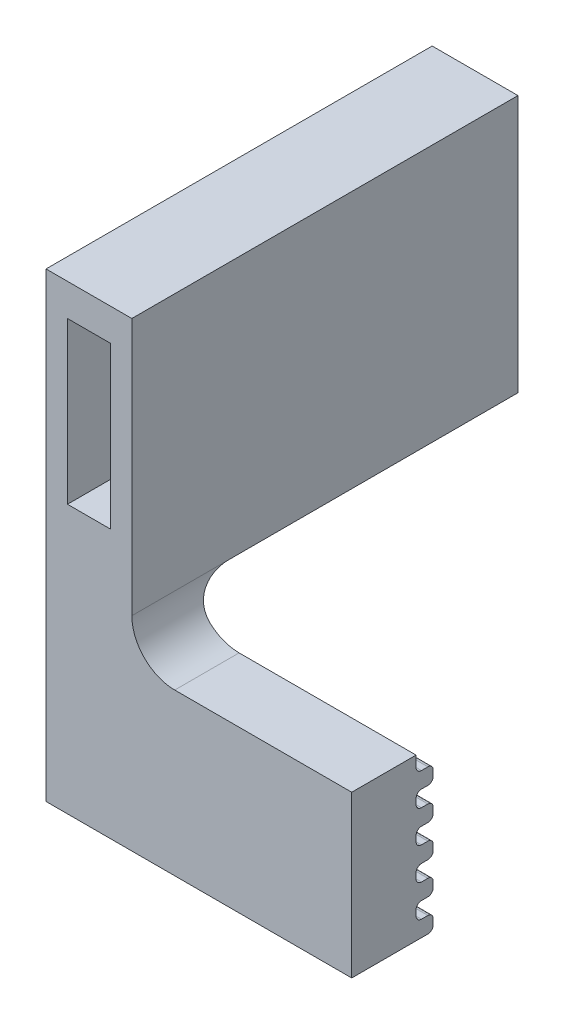
from build123d import *

# Parameters (mm, degrees)
SKETCH_1_W          = 8
SKETCH_1_H          = 24
SKETCH_1_W_2        = 4
SKETCH_1_H_2        = 15
EXTRUDE_1_DEPTH     = 8
SKETCH_1_3_W        = 8
SKETCH_1_3_H        = 24
SKETCH_1_3_W_2      = 4
SKETCH_1_3_H_2      = 15
EXTRUDE_2_DEPTH     = 28
EXTRUDE_4_DEPTH     = 6
CUT_EXTRUDE_2_DEPTH = 6
SKETCH_4_W          = 8
SKETCH_4_H          = 4
EXTRUDE_5_DEPTH     = 6
FILLET_1_R          = 2
FILLET_2_R          = 3
FILLET_3_R          = 4
SKETCH_6_W          = 1.6
SKETCH_6_H          = 1.5
EXTRUDE_7_DEPTH     = 28.5
FILLET_5_R          = 0.5


with BuildPart() as part:
    # Эскиз1 → Бобышка-Вытянуть1 (new body)
    with BuildSketch(Plane.XY):
        with Locations((4, 12)):
            Rectangle(SKETCH_1_W, SKETCH_1_H)
        with Locations((4, 13.5)):
            Rectangle(SKETCH_1_W_2, SKETCH_1_H_2, mode=Mode.SUBTRACT)
    extrude(amount=EXTRUDE_1_DEPTH)

    # Эскиз1<3> → Бобышка-Вытянуть2 (add)
    with BuildSketch(Plane.XY):
        with Locations((4, 12)):
            Rectangle(SKETCH_1_3_W, SKETCH_1_3_H)
        with Locations((4, 13.5)):
            Rectangle(SKETCH_1_3_W_2, SKETCH_1_3_H_2, mode=Mode.SUBTRACT)
    extrude(amount=-EXTRUDE_2_DEPTH)

    # Эскиз3 → Бобышка-Вытянуть4 (add)
    with BuildSketch(Plane.XZ):
        with BuildLine():
            Line((0, -14), (0, -11.5))
            Line((0, -11.5), (-1, -11.5))
            ThreePointArc((-1, -11.5), (-2.5, -10), (-1, -8.5))
            Line((-1, -8.5), (0, -8.5))
            Line((0, -8.5), (0, -6))
            Line((0, -6), (-4, -6))
            Line((-4, -6), (-4, -14))
            Line((-4, -14), (0, -14))
        make_face()
    extrude(amount=-EXTRUDE_4_DEPTH)

    # Эскиз3<3> → Вырез-Вытянуть2 (cut)
    with BuildSketch(Plane.XZ):
        with BuildLine():
            Line((-1, -11.5), (0, -11.5))
            Line((0, -11.5), (0, -8.5))
            Line((0, -8.5), (-1, -8.5))
            ThreePointArc((-1, -8.5), (-2.5, -10), (-1, -11.5))
        make_face()
        with BuildLine():
            Line((0, -11.5), (5, -11.5))
            ThreePointArc((5, -11.5), (6.5, -10), (5, -8.5))
            Line((5, -8.5), (0, -8.5))
            Line((0, -8.5), (0, -11.5))
        make_face()
    extrude(amount=-CUT_EXTRUDE_2_DEPTH, mode=Mode.SUBTRACT)

    # Эскиз4 → Бобышка-Вытянуть5 (add)
    with BuildSketch(Plane.XY.offset(8)):
        Polygon((8, -4), (0, -4), (0, -19), (28.5, -19), (28.5, -4), align=None)
        with Locations((4, -2)):
            Rectangle(SKETCH_4_W, SKETCH_4_H)
    extrude(amount=-EXTRUDE_5_DEPTH)

    # Скругление1
    fillet_1_edges = [part.edges().sort_by_distance(p)[0] for p in [
        (0, 3, -14),
        (0, 3, -6),
    ]]
    fillet(fillet_1_edges, radius=FILLET_1_R)
    fillet_1_2_edges = [part.edges().sort_by_distance(p)[0] for p in [
        (-4, 3, -14),
        (-4, 3, -6),
    ]]
    fillet(fillet_1_2_edges, radius=FILLET_1_R - 0.0001)  # a hair under: the kernel refuses the full size

    # Скругление2
    fillet_2_edges = [part.edges().sort_by_distance(p)[0] for p in [
        (4, 0, 2),
    ]]
    fillet(fillet_2_edges, radius=FILLET_2_R)

    # Скругление3
    fillet_3_edges = [part.edges().sort_by_distance(p)[0] for p in [
        (8, -4, 5),
    ]]
    fillet(fillet_3_edges, radius=FILLET_3_R - 0.0001)  # a hair under: the kernel refuses the full size

    # Эскиз6 → Бобышка-Вытянуть7 (add)
    with BuildSketch(Plane(origin=(28.5, 0, 0), x_dir=(0, 0, -1), z_dir=(1, 0, 0))):
        with Locations((-1.2, -15.25)):
            Rectangle(SKETCH_6_W, SKETCH_6_H)
        with Locations((-1.2, -18.25)):
            Rectangle(SKETCH_6_W, SKETCH_6_H)
        with Locations((-1.2, -12.25)):
            Rectangle(SKETCH_6_W, SKETCH_6_H)
        with Locations((-1.2, -9.25)):
            Rectangle(SKETCH_6_W, SKETCH_6_H)
        with Locations((-1.2, -6.25)):
            Rectangle(SKETCH_6_W, SKETCH_6_H)
    extrude(amount=-EXTRUDE_7_DEPTH)

    # Скругление5
    fillet_5_edges = [part.edges().sort_by_distance(p)[0] for p in [
        (14.25, -19, 0.4),
        (14.25, -17.5, 0.4),
        (14.25, -17.5, 2),
        (14.25, -14.5, 0.4),
        (14.25, -14.5, 2),
        (14.25, -16, 2),
        (14.25, -16, 0.4),
        (14.25, -11.5, 0.4),
        (14.25, -11.5, 2),
        (14.25, -13, 2),
        (14.25, -13, 0.4),
        (14.25, -8.5, 0.4),
        (14.25, -8.5, 2),
        (14.25, -10, 2),
        (14.25, -10, 0.4),
        (14.25, -5.5, 0.4),
        (14.25, -5.5, 2),
        (14.25, -7, 2),
        (14.25, -7, 0.4),
    ]]
    fillet(fillet_5_edges, radius=FILLET_5_R)


solid = part.part
